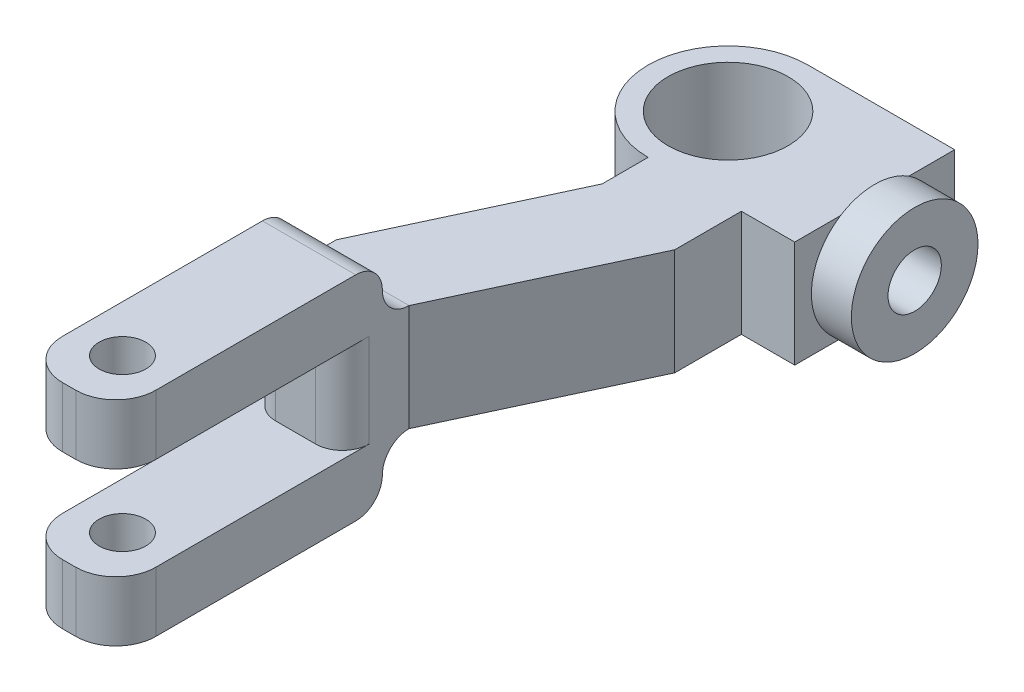
from build123d import *

# Parameters (mm, degrees)
SKETCH1_R           = 4.5
BOSS_EXTRUDE1_DEPTH = 8
SKETCH2_R           = 4.75
BOSS_EXTRUDE2_DEPTH = 3
SKETCH3_R           = 2
CUT_EXTRUDE1_DEPTH  = 5
BOSS_EXTRUDE3_DEPTH = 8
SKETCH5_W           = 7
SKETCH5_H           = 16
BOSS_EXTRUDE4_DEPTH = 20
FILLET1_START       = -7
FILLET1_DEPTH       = 18
FILLET1_START_2     = -6.339273926
FILLET1_2_DEPTH     = 7
SKETCH6_W           = 7
SKETCH6_H           = 7
CUT_EXTRUDE2_DEPTH  = 17
FILLET2_R           = 3
SKETCH7_R           = 1.75
CUT_EXTRUDE3_DEPTH  = 52.215801422
FILLET3_R           = 2


with BuildPart() as part:
    # Sketch1 → Boss-Extrude1 (new body)
    with BuildSketch(Plane(origin=(0, 0, 0), x_dir=(1, 0, 0), z_dir=(0, 1, 0))):
        with BuildLine():
            Line((0, 6), (11, 6))
            Line((11, 6), (11, -6))
            Line((11, -6), (0, -6))
            ThreePointArc((0, -6), (-6, 0), (0, 6))
        make_face()
        with Locations(Location((0, 0, 0), (0, 0, 270))):
            Circle(SKETCH1_R, mode=Mode.SUBTRACT)
    extrude(amount=BOSS_EXTRUDE1_DEPTH)

    # Sketch2 → Boss-Extrude2 (add)
    with BuildSketch(Plane(origin=(11, 0, 0), x_dir=(0, 0, -1), z_dir=(1, 0, 0))):
        with Locations(Location((0, 4, 0), (0, 0, 122.636897504))):
            Circle(SKETCH2_R)
    extrude(amount=BOSS_EXTRUDE2_DEPTH)

    # Sketch3 → Cut-Extrude1 (cut)
    with BuildSketch(Plane(origin=(14, 0, 0), x_dir=(0, 0, -1), z_dir=(1, 0, 0))):
        with Locations((0, 4)):
            Circle(SKETCH3_R)
    extrude(amount=-CUT_EXTRUDE1_DEPTH, mode=Mode.SUBTRACT)

    # Sketch4 → Boss-Extrude3 (add)
    with BuildSketch(Plane(origin=(0, 0, 0), x_dir=(1, 0, 0), z_dir=(0, 1, 0))):
        Polygon((0, -6), (0, -9.448137361), (-6.339273926, -23.042754167), (-6.339273926, -26.594616806), (0.660726074, -26.594616806), (0.660726074, -24.594616806), (7, -11), (7, -6), align=None)
    extrude(amount=BOSS_EXTRUDE3_DEPTH)

    # Sketch5 → Boss-Extrude4 (add)
    with BuildSketch(Plane.XY.offset(26.594616806)):
        with Locations((-2.839273926, 4)):
            Rectangle(SKETCH5_W, SKETCH5_H)
    extrude(amount=BOSS_EXTRUDE4_DEPTH)

    # Fillet1: read off the stored shape, not the designer's step
    # Fillet1 outline → Fillet1 (cut)
    with BuildSketch(Plane.YZ.offset(FILLET1_START)):
        with BuildLine():
            Line((-4, 26.594616806), (-2, 26.594616806))
            ThreePointArc((-2, 26.594616806), (-3.414213563, 27.180403244), (-4, 28.594616806))
            Line((-4, 28.594616806), (-4, 26.594616806))
        make_face()
        with BuildLine():
            ThreePointArc((12, 28.594616806), (11.414213563, 27.180403244), (10, 26.594616806))
            Line((10, 26.594616806), (12, 26.594616806))
            Line((12, 26.594616806), (12, 28.594616806))
        make_face()
    extrude(amount=FILLET1_DEPTH, mode=Mode.SUBTRACT)

    # Fillet1 2 outline → Fillet1 2 (add)
    with BuildSketch(Plane.YZ.offset(FILLET1_START_2)):
        with BuildLine():
            ThreePointArc((-2, 26.594616806), (-0.585786438, 26.008830368), (0, 24.594616806))
            Line((0, 24.594616806), (0, 26.594616806))
            Line((0, 26.594616806), (-2, 26.594616806))
        make_face()
        with BuildLine():
            ThreePointArc((8, 24.594616806), (8.585786438, 26.008830368), (10, 26.594616806))
            Line((10, 26.594616806), (8, 26.594616806))
            Line((8, 26.594616806), (8, 24.594616806))
        make_face()
    extrude(amount=FILLET1_2_DEPTH)

    # Sketch6 → Cut-Extrude2 (cut)
    with BuildSketch(Plane.XY.offset(46.594616806)):
        with Locations((-2.839273926, 4)):
            Rectangle(SKETCH6_W, SKETCH6_H)
    extrude(amount=-CUT_EXTRUDE2_DEPTH, mode=Mode.SUBTRACT)

    # Fillet2
    fillet2_edges = [part.edges().sort_by_distance(p)[0] for p in [
        (0.660726074, -1.75, 46.594616806),
        (-6.339273926, 9.75, 46.594616806),
        (0.660726074, 9.75, 46.594616806),
        (-6.339273926, -1.75, 46.594616806),
    ]]
    fillet(fillet2_edges, radius=FILLET2_R)

    # Sketch7 → Cut-Extrude3 (cut, through all)
    with BuildSketch(Plane(origin=(0, 12, 0), x_dir=(1, 0, 0), z_dir=(0, 1, 0))):
        with Locations(Location((-2.839273926, -42.594616806, 0), (0, 0, 180))):
            Circle(SKETCH7_R)
    extrude(amount=-CUT_EXTRUDE3_DEPTH, mode=Mode.SUBTRACT)

    # Fillet3
    fillet3_edges = [part.edges().sort_by_distance(p)[0] for p in [
        (-6.339273926, 4, 29.594616806),
        (0.660726074, 4, 29.594616806),
    ]]
    fillet(fillet3_edges, radius=FILLET3_R)


solid = part.part
